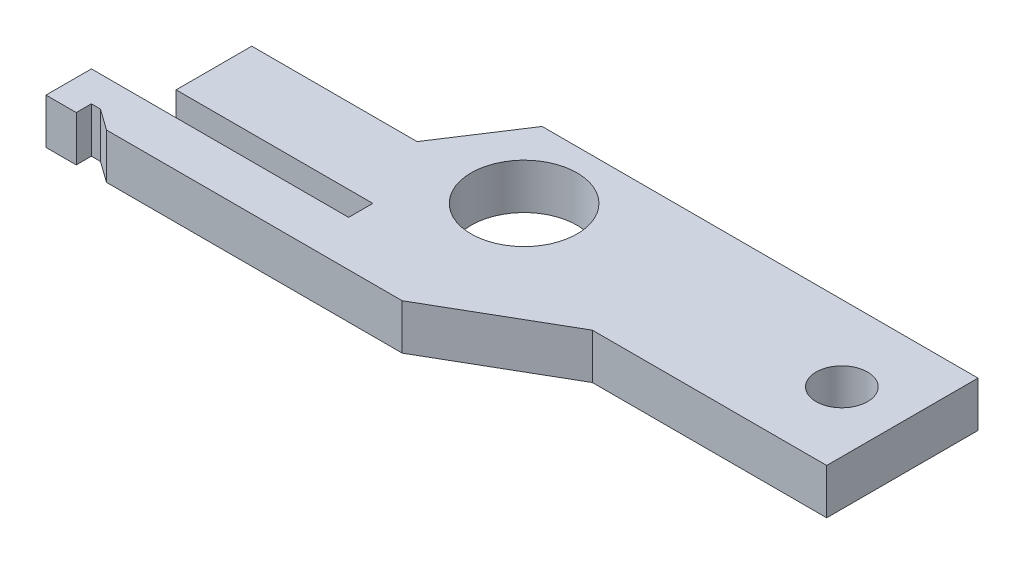
from build123d import *

# Parameters (mm, degrees)
SKETCH_2_R      = 0.85
SKETCH_2_R_2    = 1.75
EXTRUDE_1_DEPTH = 1.5


with BuildPart() as part:
    # 草图2 → 凸台-拉伸1 (new body)
    with BuildSketch(Plane(origin=(0, 7.096792112, 0), x_dir=(1, 0, 0), z_dir=(0, 1, 0))):
        Polygon((-1.9, 0), (-10.4, 0), (-10.4, -1.5), (-9.4, -1.5), (-9.4, -1), (-9.1, -1), (-8.4, -1.5), (1.371788561, -1.5), (5.355505418, 0.8), (13.1, 0.8), (13.1, 5.8), (-1.303412873, 5.8), (-2.936751866, 3.3), (-8.4, 3.3), (-8.4, 0.8), (-1.9, 0.8), align=None)
        with Locations((11.1, 3.3)):
            Circle(SKETCH_2_R, mode=Mode.SUBTRACT)
        with Locations((0.6, 3.3)):
            Circle(SKETCH_2_R_2, mode=Mode.SUBTRACT)
    extrude(amount=-EXTRUDE_1_DEPTH)


solid = part.part
